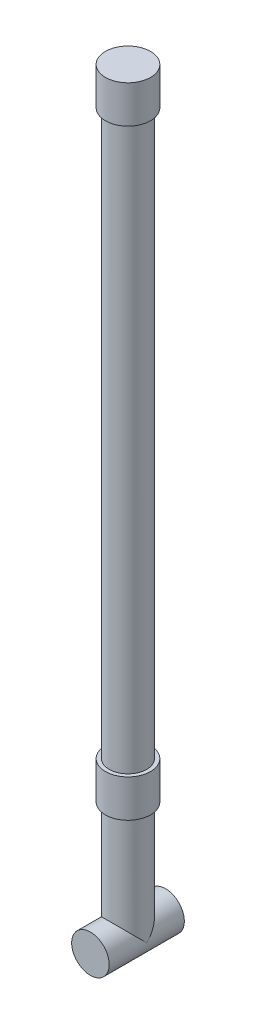
from build123d import *

# Parameters (mm, degrees)
SKETCH1_R                = 5
BOSS_EXTRUDE1_DEPTH      = 200
BOSS_EXTRUDE2_DEPTH      = 10
BOSS_EXTRUDE2_DEPTH_BACK = 10
SKETCH2_R                = 5
F_3DSKETCH1_R            = 6
BOSS_EXTRUDE3_DEPTH      = 10
BOSS_EXTRUDE4_START      = -10
SKETCH3_R                = 6
BOSS_EXTRUDE4_DEPTH      = 10


with BuildPart() as part:
    # Sketch1 → Boss-Extrude1 (new body)
    with BuildSketch(Plane(origin=(0, 0, 0), x_dir=(1, 0, 0), z_dir=(0, 1, 0))):
        Circle(SKETCH1_R)
    extrude(amount=BOSS_EXTRUDE1_DEPTH)

    # Sketch2 → Boss-Extrude2 (add, two sides: drawn at the far end of the back side and taken through both)
    with BuildSketch(Plane.XY.offset(-BOSS_EXTRUDE2_DEPTH_BACK)):
        Circle(SKETCH2_R)
    extrude(amount=BOSS_EXTRUDE2_DEPTH + BOSS_EXTRUDE2_DEPTH_BACK)

    # 3DSketch1 → Boss-Extrude3 (add)
    with BuildSketch(Plane.ZX.offset(30)):
        Circle(F_3DSKETCH1_R)
    extrude(amount=BOSS_EXTRUDE3_DEPTH)

    # Sketch3 → Boss-Extrude4 (add)
    with BuildSketch(Plane(origin=(0, 200, 0), x_dir=(1, 0, 0), z_dir=(0, 1, 0)).offset(BOSS_EXTRUDE4_START)):
        Circle(SKETCH3_R)
    extrude(amount=BOSS_EXTRUDE4_DEPTH)


solid = part.part
